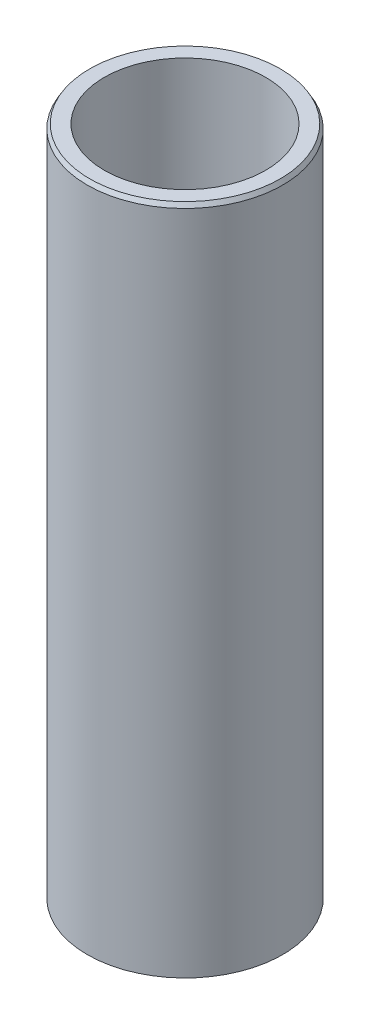
from build123d import *
from OCP.BRepFilletAPI import BRepFilletAPI_MakeChamfer

# Parameters (mm, degrees)
SKETCH1_R           = 42.5
BOSS_EXTRUDE1_DEPTH = 292.676516774
SKETCH2_R           = 35.073527936
CUT_EXTRUDE1_DEPTH  = 299.784275809
CHAMFER1_SIZE       = 1.835856632
CHAMFER1_SIZE2      = 1.059932321


with BuildPart() as part:
    # Sketch1 → Boss-Extrude1 (new body)
    with BuildSketch(Plane(origin=(0, 0, 0), x_dir=(1, 0, 0), z_dir=(0, 1, 0))):
        Circle(SKETCH1_R)
    extrude(amount=BOSS_EXTRUDE1_DEPTH)

    # Sketch2 → Cut-Extrude1 (cut, through all)
    with BuildSketch(Plane(origin=(0, 0, 0), x_dir=(1, 0, 0), z_dir=(0, 1, 0))):
        Circle(SKETCH2_R)
    extrude(amount=CUT_EXTRUDE1_DEPTH, mode=Mode.SUBTRACT)

    # Chamfer1: one chamfer whose edges measure the first distance from different faces: ONE call of the kernel's chamfer builder (chamfer() names one face for all edges)
    chamfer1_edges_1 = [part.edges().sort_by_distance(p)[0] for p in [
        (-42.5, 292.676516774, 0),
    ]]
    chamfer1_side_1 = [part.faces().sort_by_distance(p)[0] for p in [
        (-42.5, 146.338258387, 0),
    ]]
    chamfer1_edges_2 = [part.edges().sort_by_distance(p)[0] for p in [
        (-42.5, 0, 0),
    ]]
    chamfer1_side_2 = [part.faces().sort_by_distance(p)[0] for p in [
        (-41.297918472, 0, 0),
    ]]
    chamfer1 = BRepFilletAPI_MakeChamfer(part.part.solid().wrapped)
    for e in chamfer1_edges_1:
        chamfer1.Add(CHAMFER1_SIZE, CHAMFER1_SIZE2, e.wrapped, chamfer1_side_1[0].wrapped)  # the first distance lies on this face
    for e in chamfer1_edges_2:
        chamfer1.Add(CHAMFER1_SIZE, CHAMFER1_SIZE2, e.wrapped, chamfer1_side_2[0].wrapped)  # the first distance lies on this face
    add(Compound.cast(chamfer1.Shape()), mode=Mode.REPLACE)


solid = part.part
